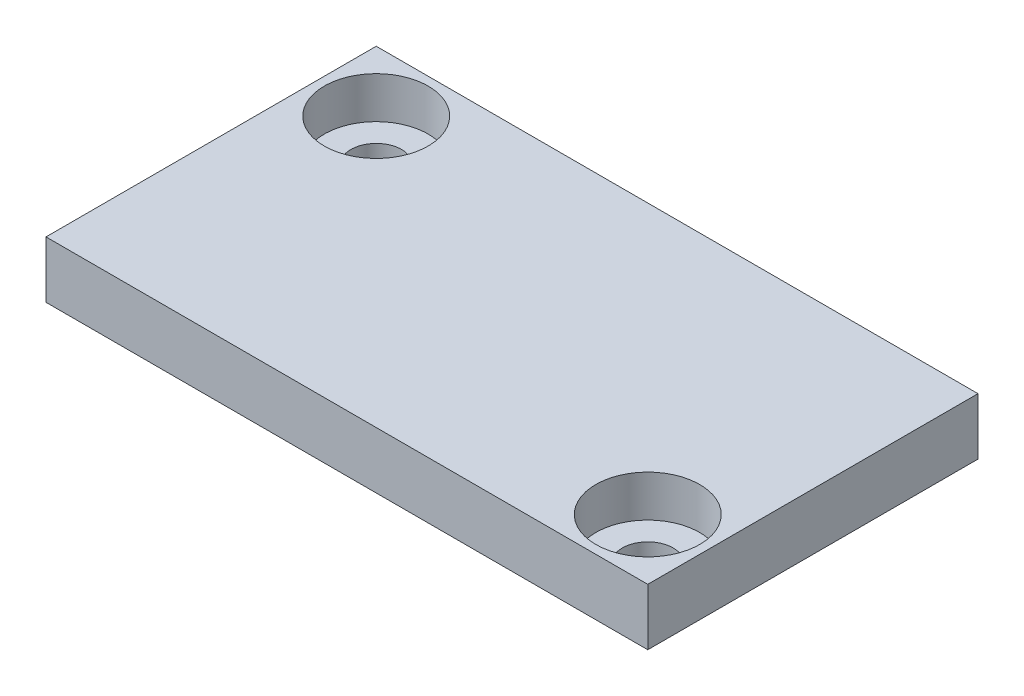
from build123d import *

# Parameters (mm, degrees)
SKETCH1_W           = 40.44093781
SKETCH1_H           = 22.193197578
BOSS_EXTRUDE1_DEPTH = 3.81
SKETCH3_R           = 3.4925
CUT_EXTRUDE3_DEPTH  = 2.794
SKETCH3_4_R         = 1.7018
CUT_EXTRUDE4_DEPTH  = 24.377723743


with BuildPart() as part:
    # Sketch1 → Boss-Extrude1 (new body)
    with BuildSketch(Plane(origin=(0, 0, 0), x_dir=(1, 0, 0), z_dir=(0, 1, 0))):
        Rectangle(SKETCH1_W, SKETCH1_H)
    extrude(amount=BOSS_EXTRUDE1_DEPTH)

    # Sketch3 → Cut-Extrude3 (cut)
    with BuildSketch(Plane(origin=(0, 3.81, 0), x_dir=(1, 0, 0), z_dir=(0, 1, 0))):
        with Locations((-16.156468905, 7.032598789)):
            Circle(SKETCH3_R)
        with Locations((16.156468905, -7.032598789)):
            Circle(SKETCH3_R)
    extrude(amount=-CUT_EXTRUDE3_DEPTH, mode=Mode.SUBTRACT)

    # Sketch3<4> → Cut-Extrude4 (cut, through all)
    with BuildSketch(Plane(origin=(0, 3.81, 0), x_dir=(1, 0, 0), z_dir=(0, 1, 0))):
        with Locations((-16.156468905, 7.032598789)):
            Circle(SKETCH3_4_R)
        with Locations((16.156468905, -7.032598789)):
            Circle(SKETCH3_4_R)
    extrude(amount=-CUT_EXTRUDE4_DEPTH, mode=Mode.SUBTRACT)


solid = part.part
